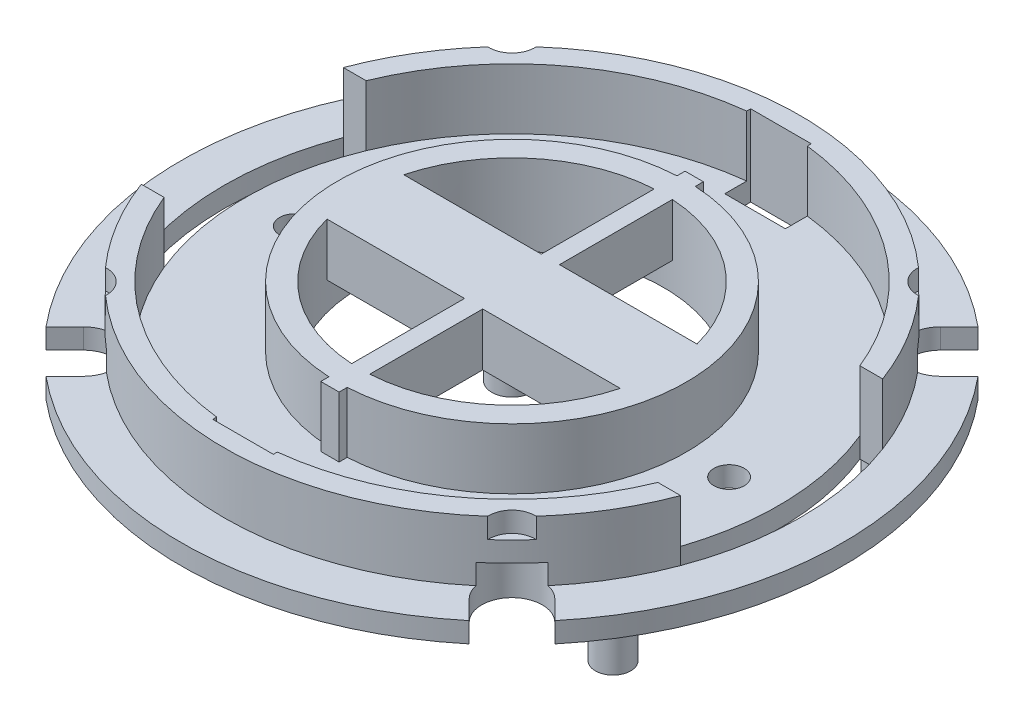
from build123d import *

# Parameters (mm, degrees)
CENTER_SPOKE_EXTRUDE_DEPTH      = 7
CENTER_SPOKE_EXTRUDE_DEPTH_BACK = 1
SKETCH1_R                       = 17.25
SKETCH1_R_2                     = 15
BASE_DEPTH                      = 1
BASE_DEPTH_BACK                 = 1
SKETCH1_4_R                     = 32.75
SKETCH1_4_W                     = 6
SKETCH1_4_H                     = 2.563127927
SKETCH1_4_R_2                   = 1.5
SKETCH3_R                       = 1.75
SPRING_FEET_DEPTH               = 6
CUT_EXTRUDE1_DEPTH              = 1.772030918
CUT_EXTRUDE1_DEPTH_BACK         = 2
SKETCH1_8_R                     = 2
BOSS_EXTRUDE3_START             = -1.5
SKETCH1_11_R                    = 2
BOSS_EXTRUDE3_DEPTH             = 8.5
BOSS_EXTRUDE4_DEPTH             = 7
CUT_EXTRUDE3_DEPTH              = 48.001329768
CUT_EXTRUDE3_DEPTH_BACK         = 48.001329768
BOSS_EXTRUDE5_START             = 2
BOSS_EXTRUDE5_DEPTH             = 4
BOSS_EXTRUDE6_START             = 2
BOSS_EXTRUDE6_DEPTH             = 2


# Read off the part's stored shape, not the designer's step: Boss-Extrude5
with BuildPart() as part:
    # Sketch1 → Center Spoke Extrude (new, two sides: drawn at the far end of the back side and taken through both)
    # profile 1 of 9: a face of its own
    with BuildSketch(Plane(origin=(0, 0, 0), x_dir=(1, 0, 0), z_dir=(0, 1, 0)).offset(-CENTER_SPOKE_EXTRUDE_DEPTH_BACK)):
        Circle(SKETCH1_R)
        Circle(SKETCH1_R_2, mode=Mode.SUBTRACT)
    # profile 2 of 9: a face of its own
    with BuildSketch(Plane(origin=(0, 0, 0), x_dir=(1, 0, 0), z_dir=(0, 1, 0)).offset(-CENTER_SPOKE_EXTRUDE_DEPTH_BACK)):
        with BuildLine():
            Line((-0.9, 14.972975656), (-0.9, 3.8))
            Line((-0.9, 3.8), (0.9, 3.8))
            Line((0.9, 3.8), (0.9, 14.972975656))
            ThreePointArc((0.9, 14.972975656), (0, 15), (-0.9, 14.972975656))
        make_face()
    # profile 3 of 9: a face of its own
    with BuildSketch(Plane(origin=(0, 0, 0), x_dir=(1, 0, 0), z_dir=(0, 1, 0)).offset(-CENTER_SPOKE_EXTRUDE_DEPTH_BACK)):
        with BuildLine():
            Line((0.9, 3.8), (-0.9, 3.8))
            Line((-0.9, 3.8), (-0.9, 1.78605711))
            ThreePointArc((-0.9, 1.78605711), (0, 2), (0.9, 1.78605711))
            Line((0.9, 1.78605711), (0.9, 3.8))
        make_face()
    # profile 4 of 9: a face of its own
    with BuildSketch(Plane(origin=(0, 0, 0), x_dir=(1, 0, 0), z_dir=(0, 1, 0)).offset(-CENTER_SPOKE_EXTRUDE_DEPTH_BACK)):
        with BuildLine():
            Line((-0.9, -1.78605711), (-0.9, -3.8))
            Line((-0.9, -3.8), (0.9, -3.8))
            Line((0.9, -3.8), (0.9, -1.78605711))
            ThreePointArc((0.9, -1.78605711), (0, -2), (-0.9, -1.78605711))
        make_face()
    # profile 5 of 9: a face of its own
    with BuildSketch(Plane(origin=(0, 0, 0), x_dir=(1, 0, 0), z_dir=(0, 1, 0)).offset(-CENTER_SPOKE_EXTRUDE_DEPTH_BACK)):
        with BuildLine():
            Line((0.9, -3.8), (-0.9, -3.8))
            Line((-0.9, -3.8), (-0.9, -14.972975656))
            ThreePointArc((-0.9, -14.972975656), (0, -15), (0.9, -14.972975656))
            Line((0.9, -14.972975656), (0.9, -3.8))
        make_face()
    # profile 6 of 9: a face of its own
    with BuildSketch(Plane(origin=(0, 0, 0), x_dir=(1, 0, 0), z_dir=(0, 1, 0)).offset(-CENTER_SPOKE_EXTRUDE_DEPTH_BACK)):
        with BuildLine():
            Line((14.510685718, 3.8), (0.9, 3.8))
            Line((0.9, 3.8), (0.9, 1.78605711))
            ThreePointArc((0.9, 1.78605711), (1.702938637, 1.048808848), (2, 0))
            ThreePointArc((2, 0), (1.702938637, -1.048808848), (0.9, -1.78605711))
            Line((0.9, -1.78605711), (0.9, -3.8))
            Line((0.9, -3.8), (14.510685718, -3.8))
            ThreePointArc((14.510685718, -3.8), (14.87716851, -1.915687113), (15, 0))
            ThreePointArc((15, 0), (14.87716851, 1.915687113), (14.510685718, 3.8))
        make_face()
    # profile 7 of 9: a face of its own
    with BuildSketch(Plane(origin=(0, 0, 0), x_dir=(1, 0, 0), z_dir=(0, 1, 0)).offset(-CENTER_SPOKE_EXTRUDE_DEPTH_BACK)):
        with BuildLine():
            Line((-0.9, 3.8), (-14.510685718, 3.8))
            ThreePointArc((-14.510685718, 3.8), (-15, 0), (-14.510685718, -3.8))
            Line((-14.510685718, -3.8), (-0.9, -3.8))
            Line((-0.9, -3.8), (-0.9, -1.78605711))
            ThreePointArc((-0.9, -1.78605711), (-2, 0), (-0.9, 1.78605711))
            Line((-0.9, 1.78605711), (-0.9, 3.8))
        make_face()
    # profile 8 of 9: a face of its own
    with BuildSketch(Plane(origin=(0, 0, 0), x_dir=(1, 0, 0), z_dir=(0, 1, 0)).offset(-CENTER_SPOKE_EXTRUDE_DEPTH_BACK)):
        with BuildLine():
            ThreePointArc((0.913235294, -17.225809162), (0.006626806, -17.249998727), (-0.9, -17.22650574))
            Line((-0.9, -17.22650574), (-0.9, -18.02650574))
            Line((-0.9, -18.02650574), (0.913235294, -18.02650574))
            Line((0.913235294, -18.02650574), (0.913235294, -17.225809162))
        make_face()
    # profile 9 of 9: a face of its own
    with BuildSketch(Plane(origin=(0, 0, 0), x_dir=(1, 0, 0), z_dir=(0, 1, 0)).offset(-CENTER_SPOKE_EXTRUDE_DEPTH_BACK)):
        with BuildLine():
            Line((-0.9, 18.02650574), (-0.9, 17.22650574))
            ThreePointArc((-0.9, 17.22650574), (0.006626806, 17.249998727), (0.913235294, 17.225809162))
            Line((0.913235294, 17.225809162), (0.913235294, 18.02650574))
            Line((0.913235294, 18.02650574), (-0.9, 18.02650574))
        make_face()
    extrude(amount=CENTER_SPOKE_EXTRUDE_DEPTH + CENTER_SPOKE_EXTRUDE_DEPTH_BACK)

    # Sketch1<4> → base (add, two sides: drawn at the far end of the back side and taken through both)
    with BuildSketch(Plane(origin=(0, 0, 0), x_dir=(1, 0, 0), z_dir=(0, 1, 0)).offset(-BASE_DEPTH_BACK)):
        with Locations(Location((0, 0, 0), (0, 0, 270))):
            Circle(SKETCH1_4_R)
        with Locations((0, -25.337952307)):
            Rectangle(SKETCH1_4_W, SKETCH1_4_H, mode=Mode.SUBTRACT)
        with BuildLine():
            ThreePointArc((-26.68801229, -10), (-28.5, 0), (-26.68801229, 10))
            Line((-26.68801229, 10), (-24.432764887, 10))
            ThreePointArc((-24.432764887, 10), (-26.4, 0), (-24.432764887, -10))
            Line((-24.432764887, -10), (-26.68801229, -10))
        make_face(mode=Mode.SUBTRACT)
        with Locations(Location((21.5, -0.011171984, 0), (0, 0, 270))):
            Circle(SKETCH1_4_R_2, mode=Mode.SUBTRACT)
        with Locations(Location((-21.5, 0, 0), (0, 0, 270))):
            Circle(SKETCH1_4_R_2, mode=Mode.SUBTRACT)
        with Locations((0, 25.337952307)):
            Rectangle(SKETCH1_4_W, SKETCH1_4_H, mode=Mode.SUBTRACT)
        with BuildLine():
            ThreePointArc((-0.9, -17.22650574), (-17.25, 0), (-0.9, 17.22650574))
            Line((-0.9, 17.22650574), (-0.9, 18.02650574))
            Line((-0.9, 18.02650574), (0.913235294, 18.02650574))
            Line((0.913235294, 18.02650574), (0.913235294, 17.225809162))
            ThreePointArc((0.913235294, 17.225809162), (17.25, 0), (0.913235294, -17.225809162))
            Line((0.913235294, -17.225809162), (0.913235294, -18.02650574))
            Line((0.913235294, -18.02650574), (-0.9, -18.02650574))
            Line((-0.9, -18.02650574), (-0.9, -17.22650574))
        make_face(mode=Mode.SUBTRACT)
        with BuildLine():
            ThreePointArc((26.68801229, 10), (28.5, 0), (26.68801229, -10))
            Line((26.68801229, -10), (24.432764887, -10))
            ThreePointArc((24.432764887, -10), (26.4, 0), (24.432764887, 10))
            Line((24.432764887, 10), (26.68801229, 10))
        make_face(mode=Mode.SUBTRACT)
    extrude(amount=BASE_DEPTH + BASE_DEPTH_BACK)

    # Sketch3 → Spring feet (add)
    with BuildSketch(Plane.XZ.offset(1)):
        with Locations(Location((-23.5, 13.5, 0), (0, 0, 90))):
            Circle(SKETCH3_R)
        with Locations(Location((23.5, 13.5, 0), (0, 0, 90))):
            Circle(SKETCH3_R)
        with Locations(Location((23.5, -13.5, 0), (0, 0, 90))):
            Circle(SKETCH3_R)
        with Locations(Location((-23.5, -13.5, 0), (0, 0, 90))):
            Circle(SKETCH3_R)
    extrude(amount=SPRING_FEET_DEPTH)

    # Sketch1<8> → Cut-Extrude1 (cut, two sides: drawn at the far end of the back side and taken through both)
    with BuildSketch(Plane(origin=(0, 0, 0), x_dir=(1, 0, 0), z_dir=(0, 1, 0)).offset(-CUT_EXTRUDE1_DEPTH_BACK)):
        with BuildLine():
            Line((14.510685718, 3.8), (0.9, 3.8))
            Line((0.9, 3.8), (0.9, 1.78605711))
            ThreePointArc((0.9, 1.78605711), (1.702938637, 1.048808848), (2, 0))
            ThreePointArc((2, 0), (1.702938637, -1.048808848), (0.9, -1.78605711))
            Line((0.9, -1.78605711), (0.9, -3.8))
            Line((0.9, -3.8), (14.510685718, -3.8))
            ThreePointArc((14.510685718, -3.8), (14.87716851, -1.915687113), (15, 0))
            ThreePointArc((15, 0), (14.87716851, 1.915687113), (14.510685718, 3.8))
        make_face()
        with BuildLine():
            Line((-0.9, 3.8), (-14.510685718, 3.8))
            ThreePointArc((-14.510685718, 3.8), (-15, 0), (-14.510685718, -3.8))
            Line((-14.510685718, -3.8), (-0.9, -3.8))
            Line((-0.9, -3.8), (-0.9, -1.78605711))
            ThreePointArc((-0.9, -1.78605711), (-2, 0), (-0.9, 1.78605711))
            Line((-0.9, 1.78605711), (-0.9, 3.8))
        make_face()
        with BuildLine():
            Line((-0.9, 14.972975656), (-0.9, 3.8))
            Line((-0.9, 3.8), (0.9, 3.8))
            Line((0.9, 3.8), (0.9, 14.972975656))
            ThreePointArc((0.9, 14.972975656), (0, 15), (-0.9, 14.972975656))
        make_face()
        with BuildLine():
            Line((-0.9, -1.78605711), (-0.9, -3.8))
            Line((-0.9, -3.8), (0.9, -3.8))
            Line((0.9, -3.8), (0.9, -1.78605711))
            ThreePointArc((0.9, -1.78605711), (0, -2), (-0.9, -1.78605711))
        make_face()
        with BuildLine():
            Line((0.9, -3.8), (-0.9, -3.8))
            Line((-0.9, -3.8), (-0.9, -14.972975656))
            ThreePointArc((-0.9, -14.972975656), (0, -15), (0.9, -14.972975656))
            Line((0.9, -14.972975656), (0.9, -3.8))
        make_face()
        with Locations(Location((0, 0, 0), (0, 0, 270))):
            Circle(SKETCH1_8_R)
        with BuildLine():
            Line((0.9, 3.8), (-0.9, 3.8))
            Line((-0.9, 3.8), (-0.9, 1.78605711))
            ThreePointArc((-0.9, 1.78605711), (0, 2), (0.9, 1.78605711))
            Line((0.9, 1.78605711), (0.9, 3.8))
        make_face()
    extrude(amount=CUT_EXTRUDE1_DEPTH + CUT_EXTRUDE1_DEPTH_BACK, mode=Mode.SUBTRACT)

    # Sketch1<11> → Boss-Extrude3 (add)
    with BuildSketch(Plane(origin=(0, 0, 0), x_dir=(1, 0, 0), z_dir=(0, 1, 0)).offset(BOSS_EXTRUDE3_START)):
        with Locations(Location((0, 0, 0), (0, 0, 270))):
            Circle(SKETCH1_11_R)
    extrude(amount=BOSS_EXTRUDE3_DEPTH)

    # Sketch1<12> → Boss-Extrude4 (add)
    with BuildSketch(Plane(origin=(0, 0, 0), x_dir=(1, 0, 0), z_dir=(0, 1, 0))):
        with BuildLine():
            ThreePointArc((-24.432764887, 10), (-15.936881419, 21.046990536), (-3, 26.228991593))
            Line((-3, 26.228991593), (-3, 26.61951627))
            Line((-3, 26.61951627), (3, 26.61951627))
            Line((3, 26.61951627), (3, 26.228991593))
            ThreePointArc((3, 26.228991593), (15.936881419, 21.046990536), (24.432764887, 10))
            Line((24.432764887, 10), (26.68801229, 10))
            ThreePointArc((26.68801229, 10), (0, 28.5), (-26.68801229, 10))
            Line((-26.68801229, 10), (-24.432764887, 10))
        make_face()
        with BuildLine():
            ThreePointArc((-3, -26.228991593), (-15.936881419, -21.046990536), (-24.432764887, -10))
            Line((-24.432764887, -10), (-26.68801229, -10))
            ThreePointArc((-26.68801229, -10), (0, -28.5), (26.68801229, -10))
            Line((26.68801229, -10), (24.432764887, -10))
            ThreePointArc((24.432764887, -10), (15.936881419, -21.046990536), (3, -26.228991593))
            Line((3, -26.228991593), (3, -26.61951627))
            Line((3, -26.61951627), (-3, -26.61951627))
            Line((-3, -26.61951627), (-3, -26.228991593))
        make_face()
    extrude(amount=BOSS_EXTRUDE4_DEPTH)

    # Sketch4 → Cut-Extrude3 (cut, two sides: drawn at the far end of the back side and taken through both)
    with BuildSketch(Plane(origin=(0, 1, 0), x_dir=(1, 0, 0), z_dir=(0, 1, 0)).offset(-CUT_EXTRUDE3_DEPTH_BACK)):
        with BuildLine():
            ThreePointArc((-20.939062351, 25.181703038), (-23.157747084, 23.157747084), (-25.181703038, 20.939062351))
            Line((-25.181703038, 20.939062351), (-23.334523779, 19.091883092))
            ThreePointArc((-23.334523779, 19.091883092), (-19.091883092, 19.091883092), (-19.091883092, 23.334523779))
            Line((-19.091883092, 23.334523779), (-20.939062351, 25.181703038))
        make_face()
        with BuildLine():
            Line((20.939062351, 25.181703038), (19.091883092, 23.334523779))
            ThreePointArc((19.091883092, 23.334523779), (19.091883092, 19.091883092), (23.334523779, 19.091883092))
            Line((23.334523779, 19.091883092), (25.181703038, 20.939062351))
            ThreePointArc((25.181703038, 20.939062351), (23.157747084, 23.157747084), (20.939062351, 25.181703038))
        make_face()
        with BuildLine():
            Line((-23.334523779, -19.091883092), (-25.181703038, -20.939062351))
            ThreePointArc((-25.181703038, -20.939062351), (-23.157747084, -23.157747084), (-20.939062351, -25.181703038))
            Line((-20.939062351, -25.181703038), (-19.091883092, -23.334523779))
            ThreePointArc((-19.091883092, -23.334523779), (-19.091883092, -19.091883092), (-23.334523779, -19.091883092))
        make_face()
        with BuildLine():
            Line((25.181703038, -20.939062351), (23.334523779, -19.091883092))
            ThreePointArc((23.334523779, -19.091883092), (19.091883092, -19.091883092), (19.091883092, -23.334523779))
            Line((19.091883092, -23.334523779), (20.939062351, -25.181703038))
            ThreePointArc((20.939062351, -25.181703038), (23.157747084, -23.157747084), (25.181703038, -20.939062351))
        make_face()
    extrude(amount=CUT_EXTRUDE3_DEPTH + CUT_EXTRUDE3_DEPTH_BACK, mode=Mode.SUBTRACT)

    # Boss-Extrude5 outline → Boss-Extrude5 (add)
    with BuildSketch(Plane(origin=(0, 1, 0), x_dir=(1, 0, 0), z_dir=(0, 1, 0)).offset(BOSS_EXTRUDE5_START)):
        with BuildLine():
            ThreePointArc((18.284161206, -21.861826296), (18.601861771, -21.5921453), (18.915585202, -21.317847839))
            ThreePointArc((18.915585202, -21.317847839), (19.586857839, -19.586857839), (21.317847839, -18.915585202))
            ThreePointArc((21.317847839, -18.915585202), (21.5921453, -18.601861771), (21.861826296, -18.284161206))
            ThreePointArc((21.861826296, -18.284161206), (19.091883092, -19.091883092), (18.284161206, -21.861826296))
        make_face()
        with BuildLine():
            ThreePointArc((-18.915585202, -21.317847839), (-18.601861771, -21.5921453), (-18.284161206, -21.861826296))
            ThreePointArc((-18.284161206, -21.861826296), (-19.091883092, -19.091883092), (-21.861826296, -18.284161206))
            ThreePointArc((-21.861826296, -18.284161206), (-21.5921453, -18.601861771), (-21.317847839, -18.915585202))
            ThreePointArc((-21.317847839, -18.915585202), (-19.586857839, -19.586857839), (-18.915585202, -21.317847839))
        make_face()
        with BuildLine():
            ThreePointArc((-18.284161206, 21.861826296), (-18.601861771, 21.5921453), (-18.915585202, 21.317847839))
            ThreePointArc((-18.915585202, 21.317847839), (-19.586857839, 19.586857839), (-21.317847839, 18.915585202))
            ThreePointArc((-21.317847839, 18.915585202), (-21.5921453, 18.601861771), (-21.861826296, 18.284161206))
            ThreePointArc((-21.861826296, 18.284161206), (-19.091883092, 19.091883092), (-18.284161206, 21.861826296))
        make_face()
        with BuildLine():
            ThreePointArc((18.915585202, 21.317847839), (18.601861771, 21.5921453), (18.284161206, 21.861826296))
            ThreePointArc((18.284161206, 21.861826296), (19.091883092, 19.091883092), (21.861826296, 18.284161206))
            ThreePointArc((21.861826296, 18.284161206), (21.5921453, 18.601861771), (21.317847839, 18.915585202))
            ThreePointArc((21.317847839, 18.915585202), (19.586857839, 19.586857839), (18.915585202, 21.317847839))
        make_face()
    extrude(amount=BOSS_EXTRUDE5_DEPTH)

    # Sketch4<4> → Boss-Extrude6 (add)
    with BuildSketch(Plane(origin=(0, 1, 0), x_dir=(1, 0, 0), z_dir=(0, 1, 0)).offset(BOSS_EXTRUDE6_START)):
        with BuildLine():
            ThreePointArc((-18.913203436, 21.213203436), (-18.913798954, 21.265539188), (-18.915585202, 21.317847839))
            ThreePointArc((-18.915585202, 21.317847839), (-20.152543264, 20.152543264), (-21.317847839, 18.915585202))
            ThreePointArc((-21.317847839, 18.915585202), (-19.6242859, 19.550271969), (-18.913203436, 21.213203436))
        make_face()
        with BuildLine():
            ThreePointArc((21.317847839, 18.915585202), (20.152543264, 20.152543264), (18.915585202, 21.317847839))
            ThreePointArc((18.915585202, 21.317847839), (19.586857839, 19.586857839), (21.317847839, 18.915585202))
        make_face()
        with BuildLine():
            ThreePointArc((18.915585202, -21.317847839), (20.152543264, -20.152543264), (21.317847839, -18.915585202))
            ThreePointArc((21.317847839, -18.915585202), (19.586857839, -19.586857839), (18.915585202, -21.317847839))
        make_face()
        with BuildLine():
            ThreePointArc((-21.317847839, -18.915585202), (-20.152543264, -20.152543264), (-18.915585202, -21.317847839))
            ThreePointArc((-18.915585202, -21.317847839), (-18.913798954, -21.265539188), (-18.913203436, -21.213203436))
            ThreePointArc((-18.913203436, -21.213203436), (-19.6242859, -19.550271969), (-21.317847839, -18.915585202))
        make_face()
    extrude(amount=BOSS_EXTRUDE6_DEPTH)


solid = part.part
